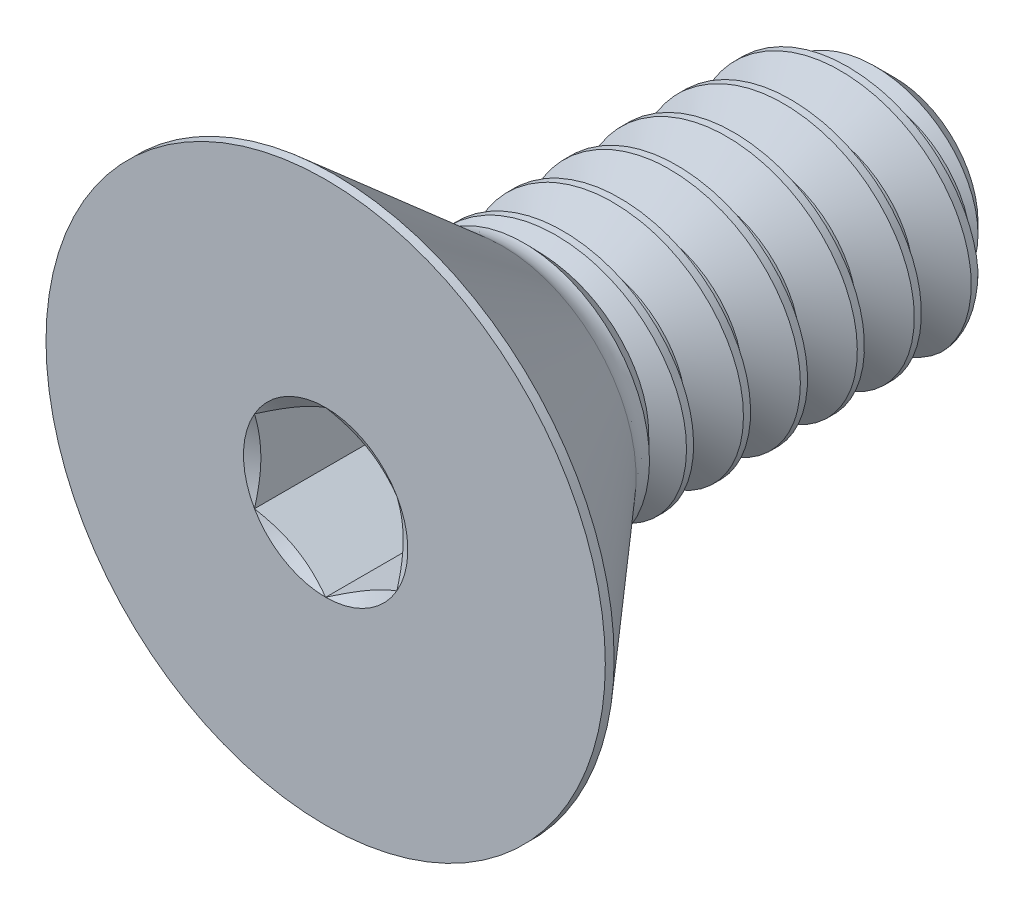
from build123d import *
from build123d.topology import SkipClean

# Parameters (mm, degrees)
SKETCH1_W          = 7.9375
SKETCH1_H          = 1.7526
CHAMFER1_SIZE      = 0.5953125
CUT_SWEEP1_PITCH   = 0.79375
CUT_EXTRUDE2_DEPTH = 1.72466


with BuildPart() as part:
    # Sketch1 → Revolve1 (revolve)
    with BuildSketch(Plane(origin=(0, 0, 0), x_dir=(0, 0, -1), z_dir=(1, 0, 0)), mode=Mode.PRIVATE) as revolve1_sk:
        with Locations((3.96875, 0.8763)):
            Rectangle(SKETCH1_W, SKETCH1_H)
    revolve(revolve1_sk.sketch.rotate(Axis((0, 0, -7.9375), (0, 0, 1)), 90), axis=Axis((0, 0, -7.9375), (0, 0, 1)))

    # Chamfer1
    chamfer1_edges = [part.edges().sort_by_distance(p)[0] for p in [
        (1.7526, 0, -7.9375),
    ]]
    chamfer(chamfer1_edges, length=CHAMFER1_SIZE)

    # Cut-Sweep1: the profile of Sketch2 profile screwed along a right-hand helix of 10 turns, 8 arcs to a turn; built about Z, then put on its axis
    with SkipClean():  # the faces are left unmerged after this step: merging them gives an invalid solid
        cut_sweep1_z = Axis((0, 0, 0), (0, 0, 1))
        cut_sweep1_corners = [(1.7529, 0, 0.000173205), (1.7529, 0, -0.694704455), (1.237044252, 0, -0.396875), (1.237044252, 0, -0.29765625)]
        with BuildLine(mode=Mode.PRIVATE) as cut_sweep1_profile:
            Line(cut_sweep1_corners[0], cut_sweep1_corners[1])
            Line(cut_sweep1_corners[1], cut_sweep1_corners[2])
            Line(cut_sweep1_corners[2], cut_sweep1_corners[3])
            Line(cut_sweep1_corners[3], cut_sweep1_corners[0])
        cut_sweep1_cap = Face(cut_sweep1_profile.wire())
        cut_sweep1_turn_angles = [0, 22.5, 45, 67.5, 90, 112.5, 135, 157.5, 180, 202.5, 225, 247.5, 270, 292.5, 315, 337.5, 360]
        cut_sweep1_turn_weights = [1, 0.9238795325112867, 1, 0.9238795325112867, 1, 0.9238795325112867, 1, 0.9238795325112867, 1, 0.9238795325112867, 1, 0.9238795325112867, 1, 0.9238795325112867, 1, 0.9238795325112867, 1]
        cut_sweep1_turn_rails = [Edge.make_bspline([Vector(p[0], p[1], 0).rotate(cut_sweep1_z, cut_sweep1_turn_angles[k]) / cut_sweep1_turn_weights[k] + Vector(0, 0, p[2] + CUT_SWEEP1_PITCH * cut_sweep1_turn_angles[k] / 360) for k in range(17)], [0, 0, 0, 1, 1, 2, 2, 3, 3, 4, 4, 5, 5, 6, 6, 7, 7, 8, 8, 8], 2, cut_sweep1_turn_weights) for p in cut_sweep1_corners]
        cut_sweep1_turn_sides = [Face.make_surface_from_curves(cut_sweep1_turn_rails[p[0]], cut_sweep1_turn_rails[p[1]]) for p in [(0, 1), (1, 2), (2, 3), (3, 0)]]
        cut_sweep1 = Plane(origin=(0, 0, -7.9375), x_dir=(0, 1, 0), z_dir=(0, 0, 1)) * Solid(Shell([*[p.moved(Location((0, 0, CUT_SWEEP1_PITCH * i))) for i in range(10) for p in cut_sweep1_turn_sides], cut_sweep1_cap, cut_sweep1_cap.rotate(cut_sweep1_z, 3600).moved(Location((0, 0, CUT_SWEEP1_PITCH * 3600 / 360)))]))
        add(cut_sweep1, mode=Mode.SUBTRACT)

    # Sketch7 → Revolve2 (revolve)
    with BuildSketch(Plane(origin=(0, 0, 0), x_dir=(0, 0, -1), z_dir=(1, 0, 0)), mode=Mode.PRIVATE) as revolve2_sk:
        with BuildLine():
            Line((0, 3.8989), (0.12319, 3.8989))
            Line((0.12319, 3.8989), (2.4638, 1.864238769))
            ThreePointArc((2.4638, 1.864238769), (2.603001936, 1.781422319), (2.76239145, 1.7526))
            Line((2.76239145, 1.7526), (2.76239145, 0))
            Line((2.76239145, 0), (0, 0))
            Line((0, 0), (0, 3.8989))
        make_face()
    revolve(revolve2_sk.sketch.rotate(Axis((0, 0, 0), (0, 0, -1)), 180), axis=Axis((0, 0, 0), (0, 0, -1)))

    # Boss-Extrude1 cone 1 section (through the dimple's axis) → Boss-Extrude1 (revolve)
    with BuildSketch(Plane(origin=(0, 0, -2.76239145), x_dir=(0, -1, 0), z_dir=(1, 0, 0))):
        Polygon((0, 0), (1.7526, 0), (0, 1.692466147), align=None)
    revolve(axis=Axis((0, 0, -2.76239145), (0, 0, -1)))

    # Sketch5 → Cut-Extrude2 (cut)
    with BuildSketch(Plane.XY):
        Polygon((0, 1.14567944), (-0.9921875, 0.57283972), (-0.9921875, -0.57283972), (0, -1.14567944), (0.9921875, -0.57283972), (0.9921875, 0.57283972), align=None)
    extrude(amount=-CUT_EXTRUDE2_DEPTH, mode=Mode.SUBTRACT)

    # Cut-Extrude3 cone 1 section (through the dimple's axis) → Cut-Extrude3 (revolve, cut)
    with BuildSketch(Plane(origin=(0, 0, 0), x_dir=(0, -1, 0), z_dir=(1, 0, 0))):
        Polygon((0, 0), (1.14567944, 0), (0, 0.661458333), align=None)
    revolve(axis=Axis((0, 0, 0), (0, 0, -1)), mode=Mode.SUBTRACT)


solid = part.part
